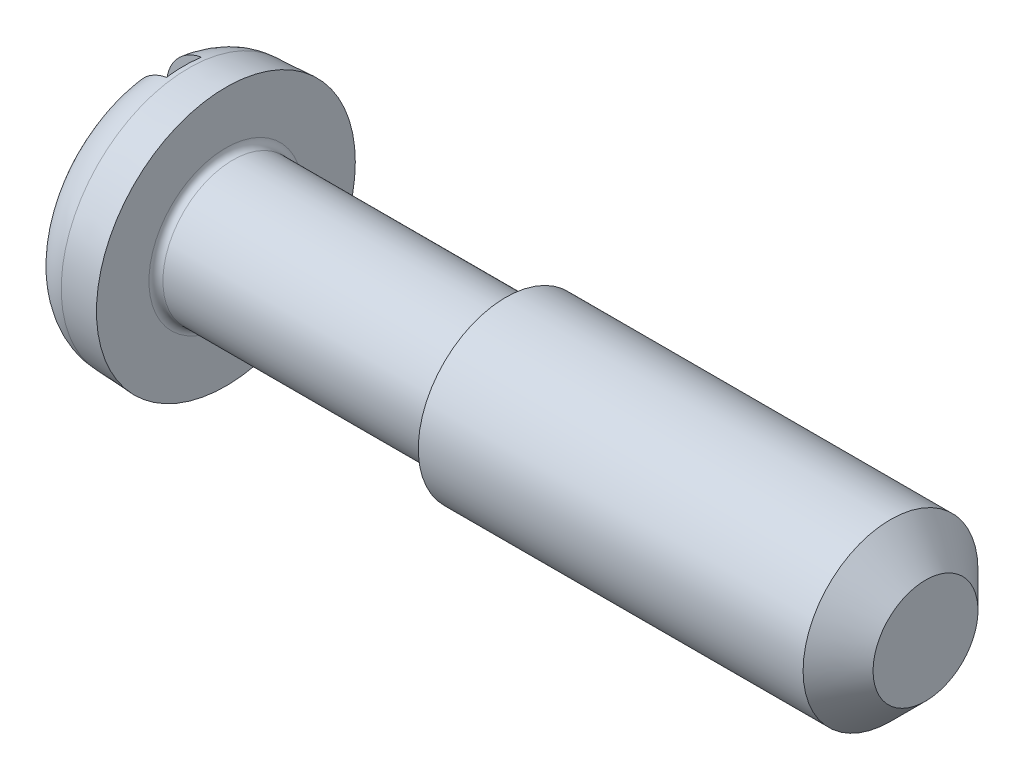
from build123d import *

# Parameters (mm, degrees)
SKETCH1_R       = 1.85
BASEHEAD_DEPTH  = 1.1
BASEHEAD_DRAFT  = -3
SKETCH2_R       = 1
BASEBODY_DEPTH  = 10
HEADFILLET_R    = 0.6
SLOT_DEPTH      = 13.390117029
SLOT_DEPTH_BACK = 13.390117029
SKETCH3_W       = 0.5
SKETCH3_H       = 0.5
SKETCH4_R       = 1.25
BASEEND_DEPTH   = 6
CHAMFER1_SIZE   = 0.5
FILLET1_R       = 0.1


with BuildPart() as part:
    # Sketch1 → BaseHead (with draft: the straight prism first)
    with BuildSketch(Plane(origin=(1.1, 0, 0), x_dir=(0, 0, -1), z_dir=(1, 0, 0))):
        Circle(SKETCH1_R)
    extrude(amount=-BASEHEAD_DEPTH)
    # BaseHead: the draft: its side faces are tilted about the plane it starts from
    basehead_sides = [part.faces().sort_by_distance(p)[0] for p in [
        (0.55, 0, 1.85),
    ]]
    draft(basehead_sides, Plane(origin=(1.1, 0, 0), x_dir=(0, 0, -1), z_dir=(1, 0, 0)), BASEHEAD_DRAFT)

    # Sketch2 → BaseBody (add)
    with BuildSketch(Plane(origin=(1.1, 0.224548484, -0.160278934), x_dir=(0, 0, -1), z_dir=(1, 0, 0))):
        with Locations((-0.160278934, -0.224548484)):
            Circle(SKETCH2_R)
    extrude(amount=BASEBODY_DEPTH)

    # HeadFillet
    headfillet_edges = [part.edges().sort_by_distance(p)[0] for p in [
        (0, 0, 1.792351443),
    ]]
    fillet(headfillet_edges, radius=HEADFILLET_R)

    # Sketch3 → Slot (cut, two sides: drawn at the far end of the back side and taken through both)
    with BuildSketch(Plane(origin=(-0.85, 0, 0.85), x_dir=(0, 0, -1), z_dir=(0, 1, 0)).offset(-SLOT_DEPTH_BACK)):
        with Locations((0.85, -1.1)):
            Rectangle(SKETCH3_W, SKETCH3_H)
    extrude(amount=SLOT_DEPTH + SLOT_DEPTH_BACK, mode=Mode.SUBTRACT)

    # Sketch4 → BaseEnd (add)
    with BuildSketch(Plane(origin=(11.1, -0.157111598, -0.758110829), x_dir=(0, 0, -1), z_dir=(1, 0, 0))):
        with Locations((-0.758110829, 0.157111598)):
            Circle(SKETCH4_R)
    extrude(amount=-BASEEND_DEPTH)

    # Chamfer1
    chamfer1_edges = [part.edges().sort_by_distance(p)[0] for p in [
        (11.1, 0, 1.25),
    ]]
    chamfer(chamfer1_edges, length=CHAMFER1_SIZE)

    # Fillet1
    fillet1_edges = [part.edges().sort_by_distance(p)[0] for p in [
        (1.1, 0, 1),
        (5.1, 0, 1),
    ]]
    fillet(fillet1_edges, radius=FILLET1_R)


solid = part.part
